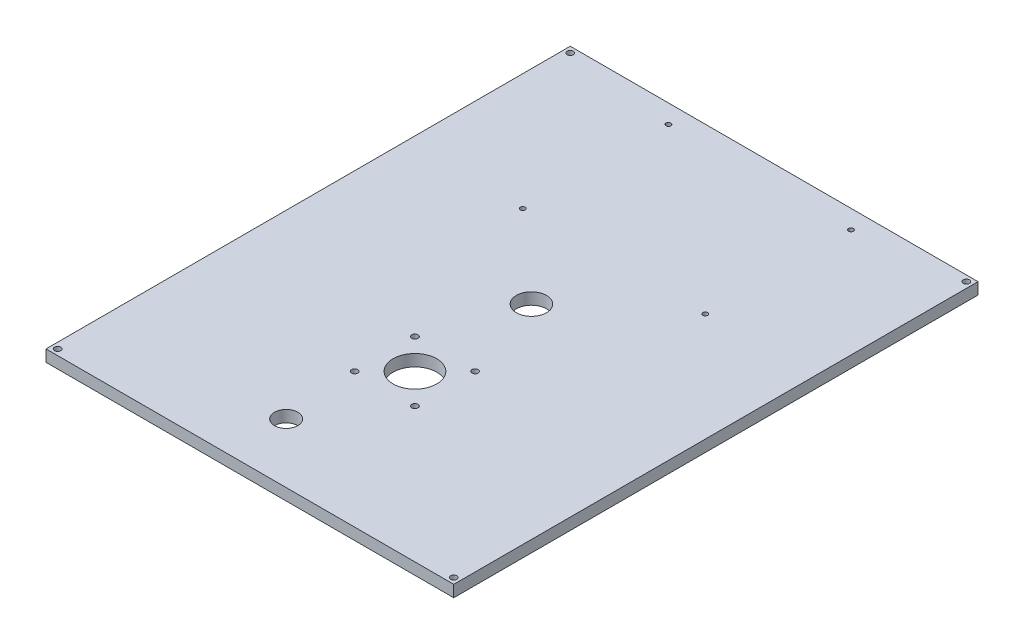
from build123d import *

# Parameters (mm, degrees)
SKETCH1_W           = 210
SKETCH1_H           = 270
SKETCH1_R           = 7.75
BOSS_EXTRUDE2_DEPTH = 6
SKETCH3_R           = 11.25
SKETCH3_R_2         = 1.6
CUT_EXTRUDE1_DEPTH  = 10
SKETCH4_R           = 1.25
CUT_EXTRUDE2_DEPTH  = 10
SKETCH5_R           = 6
CUT_EXTRUDE3_DEPTH  = 10
SKETCH6_R           = 1.6
CUT_EXTRUDE4_DEPTH  = 10


with BuildPart() as part:
    # Sketch1 → Boss-Extrude2 (new body)
    with BuildSketch(Plane(origin=(0, 0, 0), x_dir=(1, 0, 0), z_dir=(0, 1, 0))):
        with Locations((0, -10)):
            Rectangle(SKETCH1_W, SKETCH1_H)
        Circle(SKETCH1_R, mode=Mode.SUBTRACT)
    extrude(amount=BOSS_EXTRUDE2_DEPTH)

    # Sketch3 → Cut-Extrude1 (cut)
    with BuildSketch(Plane.XZ):
        with Locations((0, 60)):
            Circle(SKETCH3_R)
        with Locations((-15.5, 44.5)):
            Circle(SKETCH3_R_2)
        with Locations((15.5, 44.5)):
            Circle(SKETCH3_R_2)
        with Locations((15.5, 75.5)):
            Circle(SKETCH3_R_2)
        with Locations((-15.5, 75.5)):
            Circle(SKETCH3_R_2)
    extrude(amount=-CUT_EXTRUDE1_DEPTH, mode=Mode.SUBTRACT)

    # Sketch4 → Cut-Extrude2 (cut)
    with BuildSketch(Plane.XZ):
        with Locations((49.170333674, -115.382230576)):
            Circle(SKETCH4_R)
        with Locations((-44.829666326, -115.382230576)):
            Circle(SKETCH4_R)
        with Locations((49.170333674, -40.382230576)):
            Circle(SKETCH4_R)
        with Locations((-44.829666326, -40.382230576)):
            Circle(SKETCH4_R)
    extrude(amount=-CUT_EXTRUDE2_DEPTH, mode=Mode.SUBTRACT)

    # Sketch5 → Cut-Extrude3 (cut)
    with BuildSketch(Plane(origin=(0, 6, 0), x_dir=(1, 0, 0), z_dir=(0, 1, 0))):
        with Locations((-11.927460167, -114.387337557)):
            Circle(SKETCH5_R)
    extrude(amount=-CUT_EXTRUDE3_DEPTH, mode=Mode.SUBTRACT)

    # Sketch6 → Cut-Extrude4 (cut)
    with BuildSketch(Plane.XZ):
        with Locations((102, -122)):
            Circle(SKETCH6_R)
        with Locations((102, 142)):
            Circle(SKETCH6_R)
        with Locations((-102, 142)):
            Circle(SKETCH6_R)
        with Locations((-102, -122)):
            Circle(SKETCH6_R)
    extrude(amount=-CUT_EXTRUDE4_DEPTH, mode=Mode.SUBTRACT)


solid = part.part
